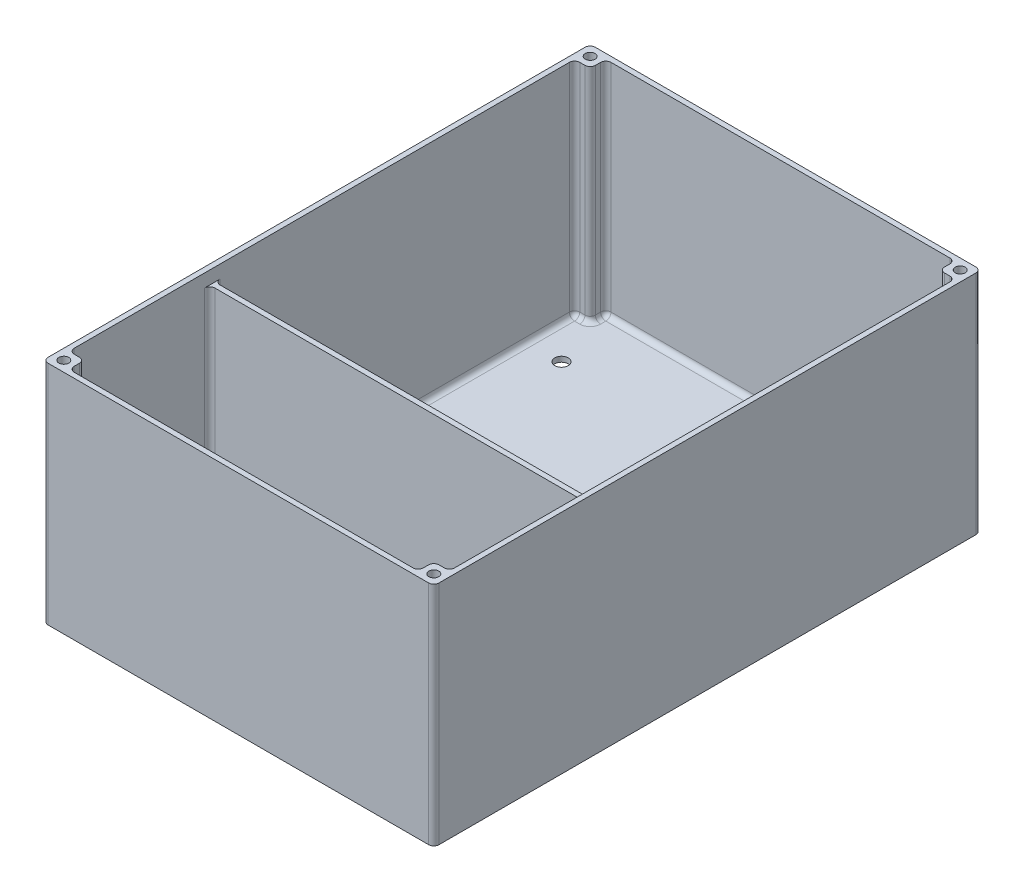
from build123d import *

# Parameters (mm, degrees)
SKETCH1_W           = 150
SKETCH1_H           = 210
BOSS_EXTRUDE3_DEPTH = 2
SKETCH3_W           = 150
SKETCH3_H           = 210
BOSS_EXTRUDE4_DEPTH = 85
FILLET1_R           = 2
SKETCH4_R           = 1.9
CUT_EXTRUDE1_DEPTH  = 10
SKETCH5_R           = 2.6
CUT_EXTRUDE2_DEPTH  = 10
SKETCH6_W           = 146
SKETCH6_H           = 2
BOSS_EXTRUDE5_DEPTH = 80
FILLET2_R           = 2


with BuildPart() as part:
    # Sketch1 → Boss-Extrude3 (new body)
    with BuildSketch(Plane(origin=(0, 0, 0), x_dir=(1, 0, 0), z_dir=(0, 1, 0))):
        with Locations((75, 105)):
            Rectangle(SKETCH1_W, SKETCH1_H)
    extrude(amount=BOSS_EXTRUDE3_DEPTH)

    # Sketch3 → Boss-Extrude4 (add)
    with BuildSketch(Plane(origin=(0, 2, 0), x_dir=(1, 0, 0), z_dir=(0, 1, 0))):
        with Locations((75, 105)):
            Rectangle(SKETCH3_W, SKETCH3_H)
        Polygon((2, 202), (2, 8), (8, 8), (8, 2), (142, 2), (142, 8), (148, 8), (148, 202), (142, 202), (142, 208), (8, 208), (8, 202), align=None, mode=Mode.SUBTRACT)
    extrude(amount=BOSS_EXTRUDE4_DEPTH)

    # Fillet1
    fillet1_edges = [part.edges().sort_by_distance(p)[0] for p in [
        (150, 43.5, -210),
        (150, 43.5, 0),
        (0, 43.5, 0),
        (0, 43.5, -210),
        (2, 44.5, -8),
        (8, 44.5, -8),
        (8, 44.5, -2),
        (142, 44.5, -2),
        (142, 44.5, -8),
        (148, 44.5, -8),
        (148, 44.5, -202),
        (142, 44.5, -202),
        (142, 44.5, -208),
        (8, 44.5, -202),
        (8, 44.5, -208),
        (2, 44.5, -202),
    ]]
    fillet(fillet1_edges, radius=FILLET1_R)

    # Sketch4 → Cut-Extrude1 (cut)
    with BuildSketch(Plane(origin=(0, 87, 0), x_dir=(1, 0, 0), z_dir=(0, 1, 0))):
        with Locations((4, 206)):
            Circle(SKETCH4_R)
        with Locations((146, 206)):
            Circle(SKETCH4_R)
        with Locations((146, 4)):
            Circle(SKETCH4_R)
        with Locations((4, 4)):
            Circle(SKETCH4_R)
    extrude(amount=-CUT_EXTRUDE1_DEPTH, mode=Mode.SUBTRACT)

    # Sketch5 → Cut-Extrude2 (cut)
    with BuildSketch(Plane(origin=(0, 2, 0), x_dir=(1, 0, 0), z_dir=(0, 1, 0))):
        with Locations((15, 184)):
            Circle(SKETCH5_R)
        with Locations((135, 184)):
            Circle(SKETCH5_R)
        with Locations((135, 76)):
            Circle(SKETCH5_R)
        with Locations((15, 76)):
            Circle(SKETCH5_R)
    extrude(amount=-CUT_EXTRUDE2_DEPTH, mode=Mode.SUBTRACT)

    # Sketch6 → Boss-Extrude5 (add)
    with BuildSketch(Plane(origin=(0, 2, 0), x_dir=(1, 0, 0), z_dir=(0, 1, 0))):
        with Locations((75, 63)):
            Rectangle(SKETCH6_W, SKETCH6_H)
    extrude(amount=BOSS_EXTRUDE5_DEPTH)

    # Fillet2
    fillet2_edges = [part.edges().sort_by_distance(p)[0] for p in [
        (148, 2, -36),
        (147.414213562, 2, -8.585786438),
        (145, 2, -8),
        (142.585786438, 2, -7.414213562),
        (142, 2, -5),
        (141.414213562, 2, -2.585786438),
        (75, 2, -2),
        (8.585786438, 2, -2.585786438),
        (8, 2, -5),
        (7.414213562, 2, -7.414213562),
        (5, 2, -8),
        (2.585786438, 2, -8.585786438),
        (148, 2, -132),
        (147.414213562, 2, -201.414213562),
        (145, 2, -202),
        (142.585786438, 2, -202.585786438),
        (142, 2, -205),
        (141.414213562, 2, -207.414213562),
        (75, 2, -208),
        (8.585786438, 2, -207.414213562),
        (8, 2, -205),
        (7.414213562, 2, -202.585786438),
        (5, 2, -202),
        (2.585786438, 2, -201.414213562),
        (2, 2, -36),
        (2, 42, -62),
        (75, 2, -62),
        (148, 42, -62),
        (148, 42, -64),
        (2, 42, -64),
        (75, 2, -64),
        (2, 2, -132),
    ]]
    fillet(fillet2_edges, radius=FILLET2_R)


solid = part.part
